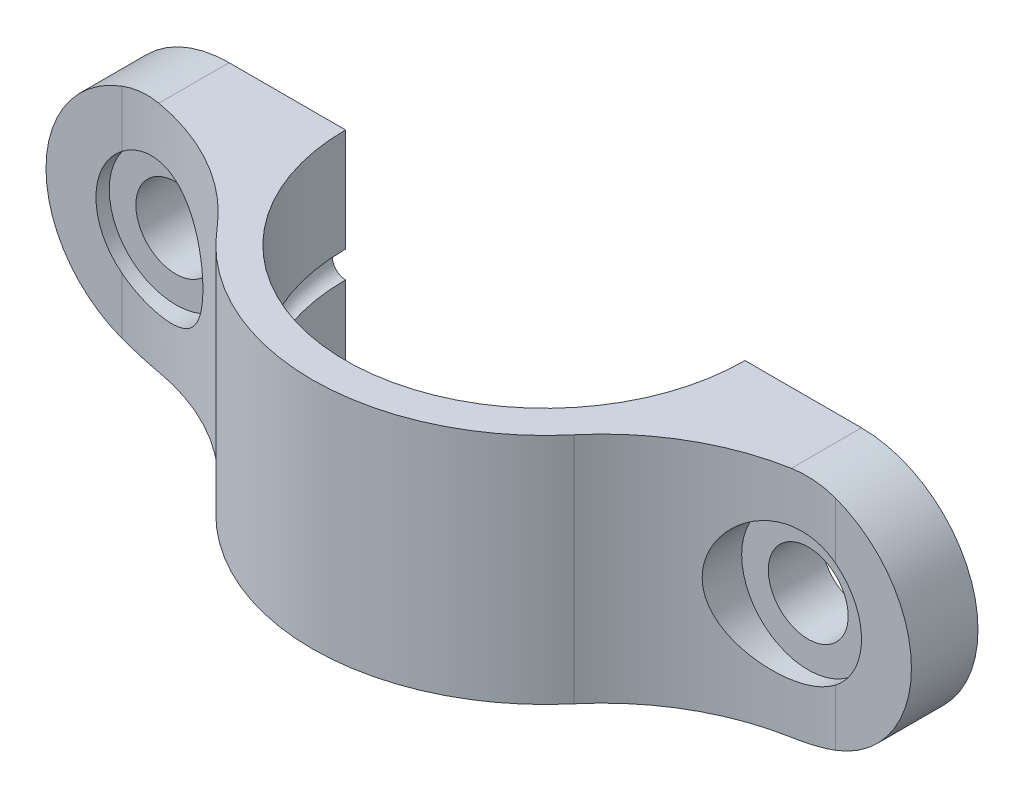
from build123d import *

# Parameters (mm, degrees)
BOSS_EXTRUDE1_DEPTH = 17.5
SKETCH2_R           = 6
CUT_EXTRUDE1_DEPTH  = 35
SKETCH3_R           = 2
FILLET1_DEPTH       = 35
FILLET2_DEPTH       = 35
CUT_EXTRUDE2_START  = -8
SKETCH4_R           = 10
CUT_EXTRUDE2_DEPTH  = 35


with BuildPart() as part:
    # Sketch1 → Boss-Extrude1 (new, symmetric)
    with BuildSketch(Plane(origin=(0, 0, 0), x_dir=(1, 0, 0), z_dir=(0, 1, 0))):
        with BuildLine():
            Line((30, 0), (65, 0))
            Line((65, 0), (65, -10))
            Line((65, -10), (53.619026474, -10))
            ThreePointArc((53.619026474, -10), (38.828827016, -13.278556149), (26.809513237, -22.5))
            ThreePointArc((26.809513237, -22.5), (0, -35), (-26.809513237, -22.5))
            ThreePointArc((-26.809513237, -22.5), (-38.828827016, -13.278556149), (-53.619026474, -10))
            Line((-53.619026474, -10), (-65, -10))
            Line((-65, -10), (-65, 0))
            Line((-65, 0), (-30, 0))
            ThreePointArc((-30, 0), (0, -30), (30, 0))
        make_face()
    extrude(amount=BOSS_EXTRUDE1_DEPTH, both=True)

    # Sketch2 → Cut-Extrude1 (cut)
    with BuildSketch(Plane(origin=(0, 0, 0), x_dir=(-1, 0, 0), z_dir=(0, 0, -1))):
        with Locations((47.5, 0)):
            Circle(SKETCH2_R)
        with Locations((-47.5, 0)):
            Circle(SKETCH2_R)
    extrude(amount=-CUT_EXTRUDE1_DEPTH, mode=Mode.SUBTRACT)

    # Sketch3 → Cut-Revolve1 (revolve, cut)
    with BuildSketch(Plane(origin=(0, 0, 0), x_dir=(-1, 0, 0), z_dir=(0, 0, -1))):
        with Locations((30, 0)):
            Circle(SKETCH3_R)
    revolve(axis=Axis((0, 17.5, 0), (0, -1, 0)), mode=Mode.SUBTRACT)

    # Fillet1: read off the stored shape, not the designer's step
    # Fillet1 outline → Fillet1 (cut)
    with BuildSketch(Plane.XY):
        with BuildLine():
            Line((65, 17.5), (47.5, 17.5))
            ThreePointArc((47.5, 17.5), (59.87436864, 12.374368701), (65, 8.6e-08))
            Line((65, 8.6e-08), (65, 17.5))
        make_face()
        with BuildLine():
            Line((65, -17.5), (65, 8.6e-08))
            ThreePointArc((65, 8.6e-08), (59.874368701, -12.374368641), (47.499999999, -17.5))
            Line((47.499999999, -17.5), (65, -17.5))
        make_face()
    extrude(amount=FILLET1_DEPTH, mode=Mode.SUBTRACT)

    # Fillet2: read off the stored shape, not the designer's step
    # Fillet2 outline → Fillet2 (cut)
    with BuildSketch(Plane.XY):
        with BuildLine():
            ThreePointArc((-47.5, -17.5), (-59.874368677, -12.374368665), (-65, 1.8e-08))
            Line((-65, 1.8e-08), (-65, -17.5))
            Line((-65, -17.5), (-47.5, -17.5))
        make_face()
        with BuildLine():
            ThreePointArc((-65, 1.8e-08), (-59.874368665, 12.374368677), (-47.5, 17.5))
            Line((-47.5, 17.5), (-65, 17.5))
            Line((-65, 17.5), (-65, 1.8e-08))
        make_face()
    extrude(amount=FILLET2_DEPTH, mode=Mode.SUBTRACT)

    # Sketch4 → Cut-Extrude2 (cut)
    with BuildSketch(Plane(origin=(0, 0, 0), x_dir=(-1, 0, 0), z_dir=(0, 0, -1)).offset(CUT_EXTRUDE2_START)):
        with Locations((-47.5, 0)):
            Circle(SKETCH4_R)
        with Locations((47.5, 0)):
            Circle(SKETCH4_R)
    extrude(amount=-CUT_EXTRUDE2_DEPTH, mode=Mode.SUBTRACT)


solid = part.part
